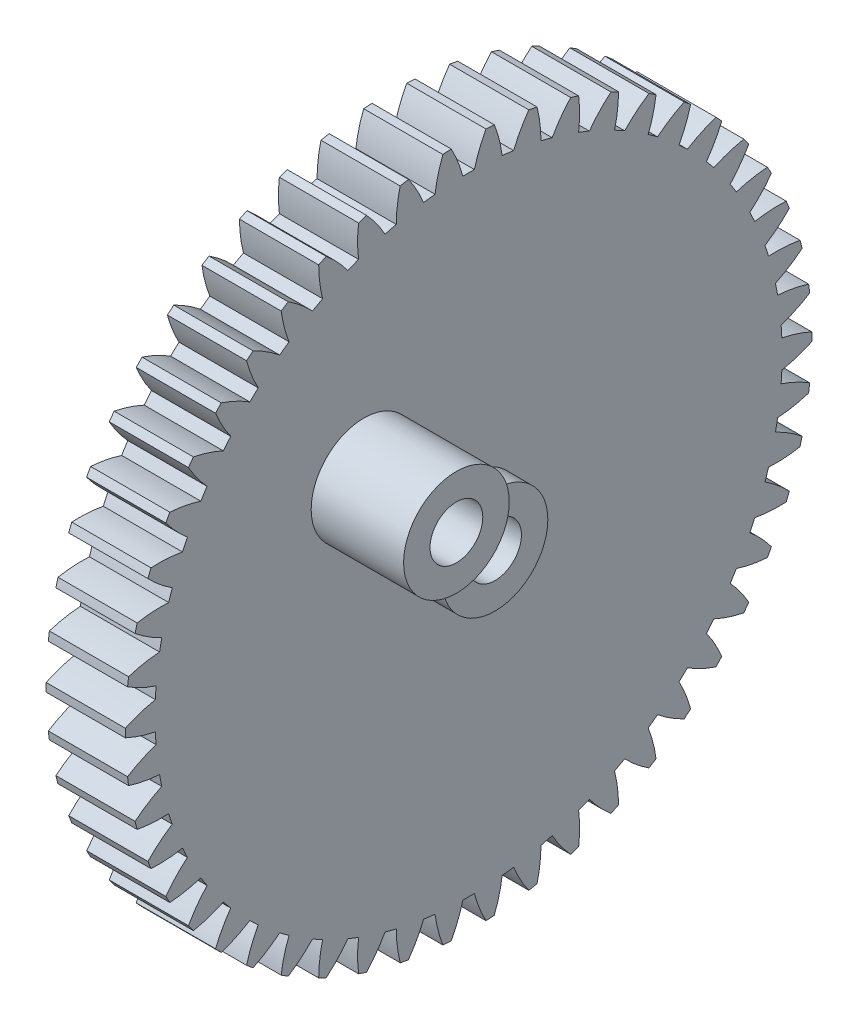
from build123d import *

# Parameters (mm, degrees)
BASPROSKE_W         = 3
BASPROSKE_H         = 13
TOOTHCUT_DEPTH      = 19.62793601
TEETHCUTS_COUNT     = 50
TEETHCUTS_ANGLE     = 352.8
BORSKE_R            = 1
BORE_DEPTH          = 50.0000508
SKETCH_1_R          = 1
CUT_EXTRUDE_1_DEPTH = 19.616311207
SKETCH_2_R          = 4
SKETCH_2_R_2        = 1
EXTRUDE_1_DEPTH     = 1.5
FILLET_1_R          = 1.5
EXTRUDE_START       = 3.5
SKETCH_3_R          = 2
SKETCH_3_R_2        = 1
EXTRUDE_2_DEPTH     = 3.5
EXTRUDE_START_2     = 1
SKETCH_5_R          = 2
SKETCH_5_R_2        = 1
EXTRUDE_3_DEPTH     = 1


with BuildPart() as part:
    # BasProSke → Base-Revolve (revolve)
    with BuildSketch(Plane(origin=(0, 0, 0), x_dir=(1, 0, 0), z_dir=(0, 1, 0)), mode=Mode.PRIVATE) as base_revolve_sk:
        with Locations((1.5, 6.5)):
            Rectangle(BASPROSKE_W, BASPROSKE_H)
    revolve(base_revolve_sk.sketch.rotate(Axis((-10, 0, 0), (1, 0, 0)), 180), axis=Axis((-10, 0, 0), (1, 0, 0)))

    # TooCutSke → ToothCut (cut, through all)
    with BuildSketch(Plane(origin=(0, 0, 0), x_dir=(0, 0, -1), z_dir=(1, 0, 0))):
        with BuildLine():
            ThreePointArc((0.218701072, 11.871985758), (0, 11.874), (-0.218701072, 11.871985758))
            ThreePointArc((-0.218701072, 11.871985758), (-0.410224227, 12.453928998), (-0.671481128, 13.008080498))
            ThreePointArc((-0.671481128, 13.008080498), (0, 13.0254), (0.671481128, 13.008080498))
            ThreePointArc((0.671481128, 13.008080498), (0.410224227, 12.453928998), (0.218701072, 11.871985758))
        make_face()
    toothcut = extrude(amount=TOOTHCUT_DEPTH, mode=Mode.SUBTRACT)

    # TeethCuts: ToothCut ×50 about axis
    teethcuts_axis = Axis((-10, 0, 0), (1, 0, 0))
    for i in range(1, TEETHCUTS_COUNT):
        add(toothcut.rotate(teethcuts_axis, i * TEETHCUTS_ANGLE / (TEETHCUTS_COUNT - 1)), mode=Mode.SUBTRACT)

    # BorSke → Bore (cut, symmetric)
    with BuildSketch(Plane(origin=(0, 0, 0), x_dir=(0, 0, -1), z_dir=(1, 0, 0))):
        with Locations(Location((0, 0, 0), (0, 0, 180))):
            Circle(BORSKE_R)
    extrude(amount=BORE_DEPTH, both=True, mode=Mode.SUBTRACT)

    # 草图1 → 切除-拉伸1 (cut, through all)
    with BuildSketch(Plane(origin=(3, 0, 0), x_dir=(0, 0, -1), z_dir=(1, 0, 0))):
        with Locations((-3.962216563, 3.814556319)):
            Circle(SKETCH_1_R)
    extrude(amount=-CUT_EXTRUDE_1_DEPTH, mode=Mode.SUBTRACT)

    # 草图2 → 凸台-拉伸1 (add)
    with BuildSketch(Plane.ZY):
        with Locations(Location((0, 0, 0), (0, 0, 180))):
            Circle(SKETCH_2_R)
        Circle(SKETCH_2_R_2, mode=Mode.SUBTRACT)
    extrude(amount=EXTRUDE_1_DEPTH)

    # 圆角1
    fillet_1_edges = [part.edges().sort_by_distance(p)[0] for p in [
        (-1.5, 0, 4),
    ]]
    fillet(fillet_1_edges, radius=FILLET_1_R - 0.0001)  # a hair under: the kernel refuses the full size

    # 草图3 → 凸台-拉伸2 (add)
    with BuildSketch(Plane(origin=(3, 0, 0), x_dir=(0, 0, -1), z_dir=(1, 0, 0)).offset(EXTRUDE_START)):
        with Locations(Location((-3.962216563, 3.814556319, 0), (0, 0, 180))):
            Circle(SKETCH_3_R)
        with Locations((-3.962216563, 3.814556319)):
            Circle(SKETCH_3_R_2, mode=Mode.SUBTRACT)
    extrude(amount=-EXTRUDE_2_DEPTH)

    # 草图5 → 凸台-拉伸3 (add)
    with BuildSketch(Plane(origin=(3, 0, 0), x_dir=(0, 0, -1), z_dir=(1, 0, 0)).offset(EXTRUDE_START_2)):
        with Locations(Location((0, 0, 0), (0, 0, 180))):
            Circle(SKETCH_5_R)
        with Locations(Location((0, 0, 0), (0, 0, 180))):
            Circle(SKETCH_5_R_2, mode=Mode.SUBTRACT)
    extrude(amount=-EXTRUDE_3_DEPTH)


solid = part.part
